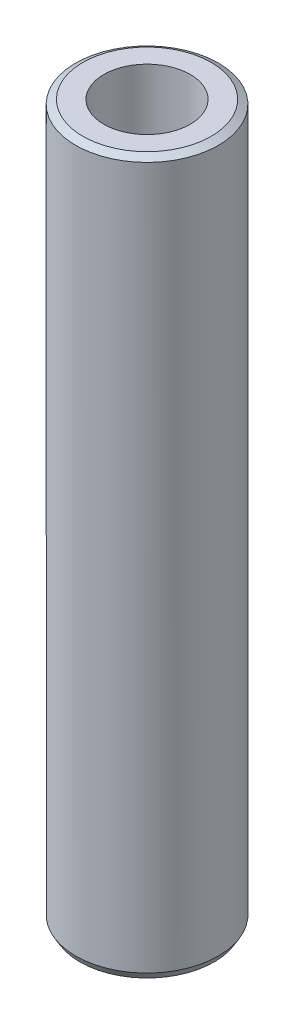
from build123d import *
from OCP.BRepFilletAPI import BRepFilletAPI_MakeChamfer

# Parameters (mm, degrees)
SKETCH1_R           = 60
BOSS_EXTRUDE1_DEPTH = 600
SKETCH2_R           = 36.319802532
CUT_EXTRUDE1_DEPTH  = 606.970296302
CHAMFER1_SIZE       = 3.516404241
CHAMFER1_SIZE2      = 6.090590806


with BuildPart() as part:
    # Sketch1 → Boss-Extrude1 (new body)
    with BuildSketch(Plane(origin=(0, 0, 0), x_dir=(1, 0, 0), z_dir=(0, 1, 0))):
        Circle(SKETCH1_R)
    extrude(amount=BOSS_EXTRUDE1_DEPTH)

    # Sketch2 → Cut-Extrude1 (cut, through all)
    with BuildSketch(Plane(origin=(0, 0, 0), x_dir=(1, 0, 0), z_dir=(0, 1, 0))):
        Circle(SKETCH2_R)
    extrude(amount=CUT_EXTRUDE1_DEPTH, mode=Mode.SUBTRACT)

    # Chamfer1: one chamfer whose edges measure the first distance from different faces: ONE call of the kernel's chamfer builder (chamfer() names one face for all edges)
    chamfer1_edges_1 = [part.edges().sort_by_distance(p)[0] for p in [
        (-60, 600, 0),
    ]]
    chamfer1_side_1 = [part.faces().sort_by_distance(p)[0] for p in [
        (-60, 300, 0),
    ]]
    chamfer1_edges_2 = [part.edges().sort_by_distance(p)[0] for p in [
        (-60, 0, 0),
    ]]
    chamfer1_side_2 = [part.faces().sort_by_distance(p)[0] for p in [
        (-58.302943725, 0, 0),
    ]]
    chamfer1 = BRepFilletAPI_MakeChamfer(part.part.solid().wrapped)
    for e in chamfer1_edges_1:
        chamfer1.Add(CHAMFER1_SIZE, CHAMFER1_SIZE2, e.wrapped, chamfer1_side_1[0].wrapped)  # the first distance lies on this face
    for e in chamfer1_edges_2:
        chamfer1.Add(CHAMFER1_SIZE, CHAMFER1_SIZE2, e.wrapped, chamfer1_side_2[0].wrapped)  # the first distance lies on this face
    add(Compound.cast(chamfer1.Shape()), mode=Mode.REPLACE)


solid = part.part
